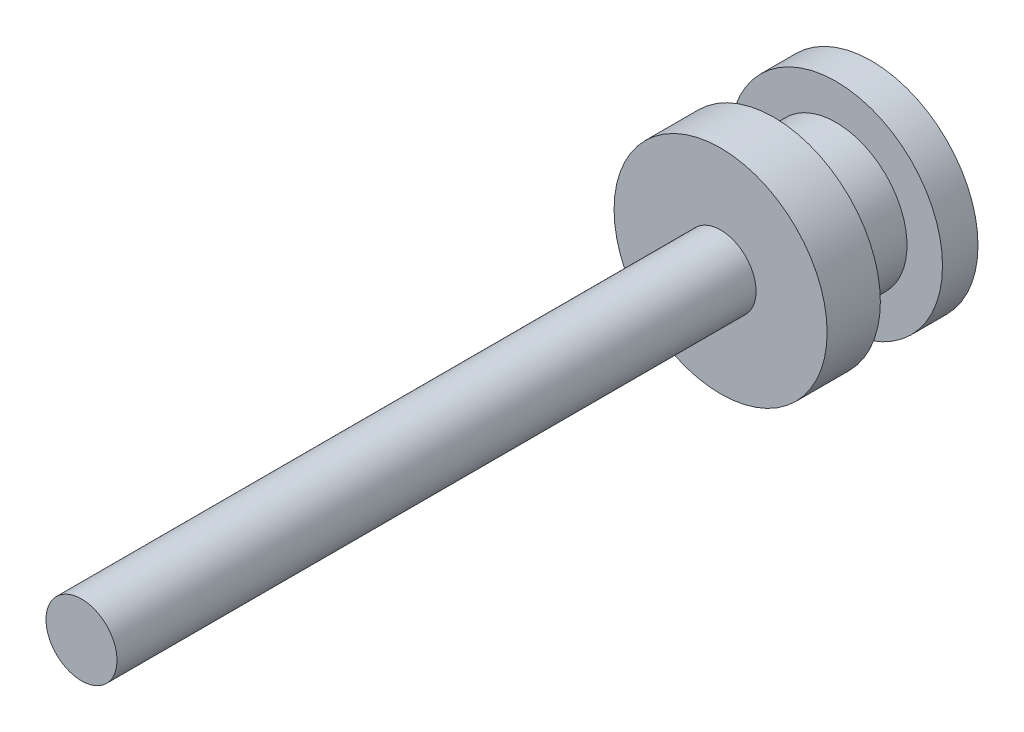
from build123d import *

# Parameters (mm, degrees)
SKIZZE1_R                       = 60
AUFSATZ_LINEAR_AUSTRAGEN1_DEPTH = 30
SKIZZE2_R                       = 20
AUFSATZ_LINEAR_AUSTRAGEN2_DEPTH = 360
SKIZZE3_R                       = 40
AUFSATZ_LINEAR_AUSTRAGEN3_DEPTH = 35
AUFSATZ_LINEAR_START            = 20
SKIZZE4_R                       = 60
AUFSATZ_LINEAR_AUSTRAGEN4_DEPTH = 20


with BuildPart() as part:
    # Skizze1 → Aufsatz-Linear austragen1 (new body)
    with BuildSketch(Plane.XY):
        Circle(SKIZZE1_R)
    extrude(amount=AUFSATZ_LINEAR_AUSTRAGEN1_DEPTH)

    # Skizze2 → Aufsatz-Linear austragen2 (add)
    with BuildSketch(Plane.XY.offset(30)):
        Circle(SKIZZE2_R)
    extrude(amount=AUFSATZ_LINEAR_AUSTRAGEN2_DEPTH)

    # Skizze3 → Aufsatz-Linear austragen3 (add)
    with BuildSketch(Plane(origin=(0, 0, 0), x_dir=(-1, 0, 0), z_dir=(0, 0, -1))):
        Circle(SKIZZE3_R)
    extrude(amount=AUFSATZ_LINEAR_AUSTRAGEN3_DEPTH)

    # Skizze4 → Aufsatz-Linear austragen4 (add)
    with BuildSketch(Plane(origin=(0, 0, -35), x_dir=(-1, 0, 0), z_dir=(0, 0, -1)).offset(AUFSATZ_LINEAR_START)):
        Circle(SKIZZE4_R)
    extrude(amount=-AUFSATZ_LINEAR_AUSTRAGEN4_DEPTH)


solid = part.part
